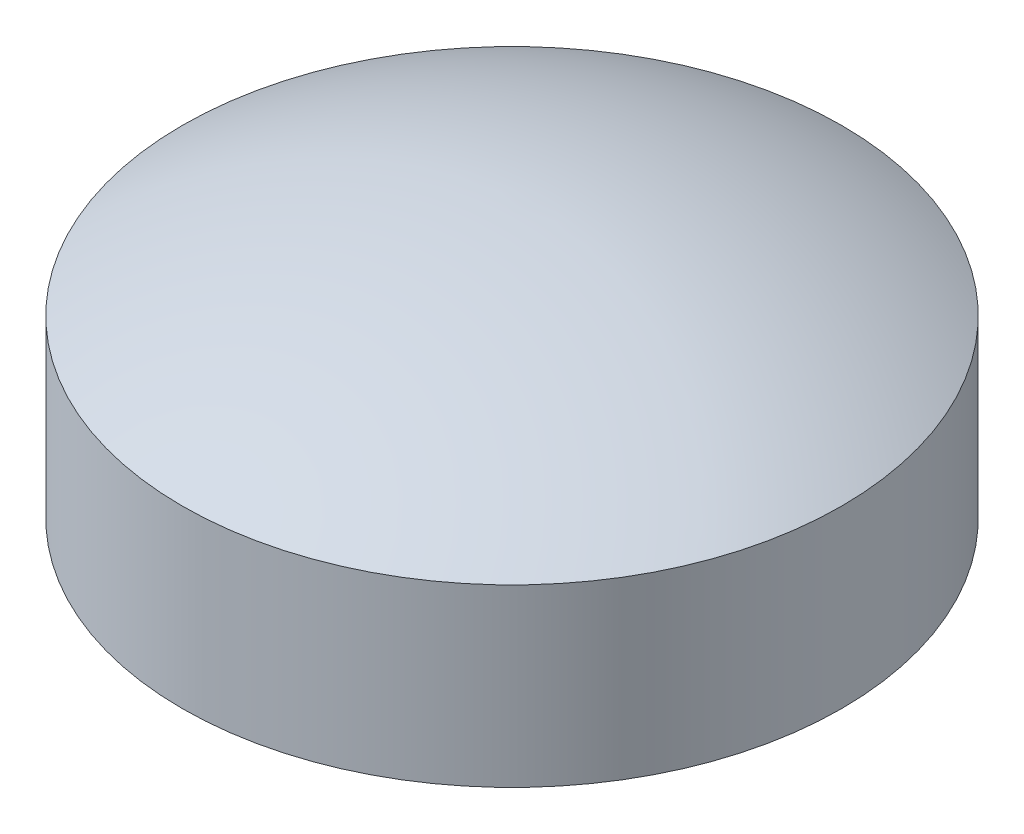
from build123d import *

# Parameters (mm, degrees)
CUT_EXTRUDE1_DEPTH      = 65.062469512
CUT_EXTRUDE1_DEPTH_BACK = 65.062469512
SKETCH6_R               = 30
SKETCH6_R_2             = 15
CUT_EXTRUDE3_REACH      = 54.479
SKETCH6_5_R             = 15


with BuildPart() as part:
    # Sketch5 → Revolve1 (revolve)
    with BuildSketch(Plane.XY):
        with BuildLine():
            Line((0, 12), (0, -48))
            ThreePointArc((0, -48), (-30, -18), (0, 12))
        make_face()
    revolve(axis=Axis((0, -1004.219311823, 0), (0, 1, 0)))

    # Sketch6 → Cut-Extrude1 (cut, two sides: drawn at the far end of the back side and taken through both)
    with BuildSketch(Plane(origin=(0, 0, 0), x_dir=(1, 0, 0), z_dir=(0, 1, 0)).offset(-CUT_EXTRUDE1_DEPTH_BACK)):
        Circle(SKETCH6_R)
        Circle(SKETCH6_R_2, mode=Mode.SUBTRACT)
    extrude(amount=CUT_EXTRUDE1_DEPTH + CUT_EXTRUDE1_DEPTH_BACK, mode=Mode.SUBTRACT)

    # Sketch6<5> → Cut-Extrude3 (cut, up to next)
    with BuildSketch(Plane(origin=(0, 0, 0), x_dir=(1, 0, 0), z_dir=(0, 1, 0)), mode=Mode.PRIVATE) as cut_extrude3_sk1:
        Circle(SKETCH6_5_R)
    cut_extrude3_tool1 = extrude(cut_extrude3_sk1.sketch, amount=-CUT_EXTRUDE3_REACH, mode=Mode.PRIVATE) & part.part
    add(cut_extrude3_tool1.solids().sort_by_distance((0, 0, 0))[0], mode=Mode.SUBTRACT)


solid = part.part
